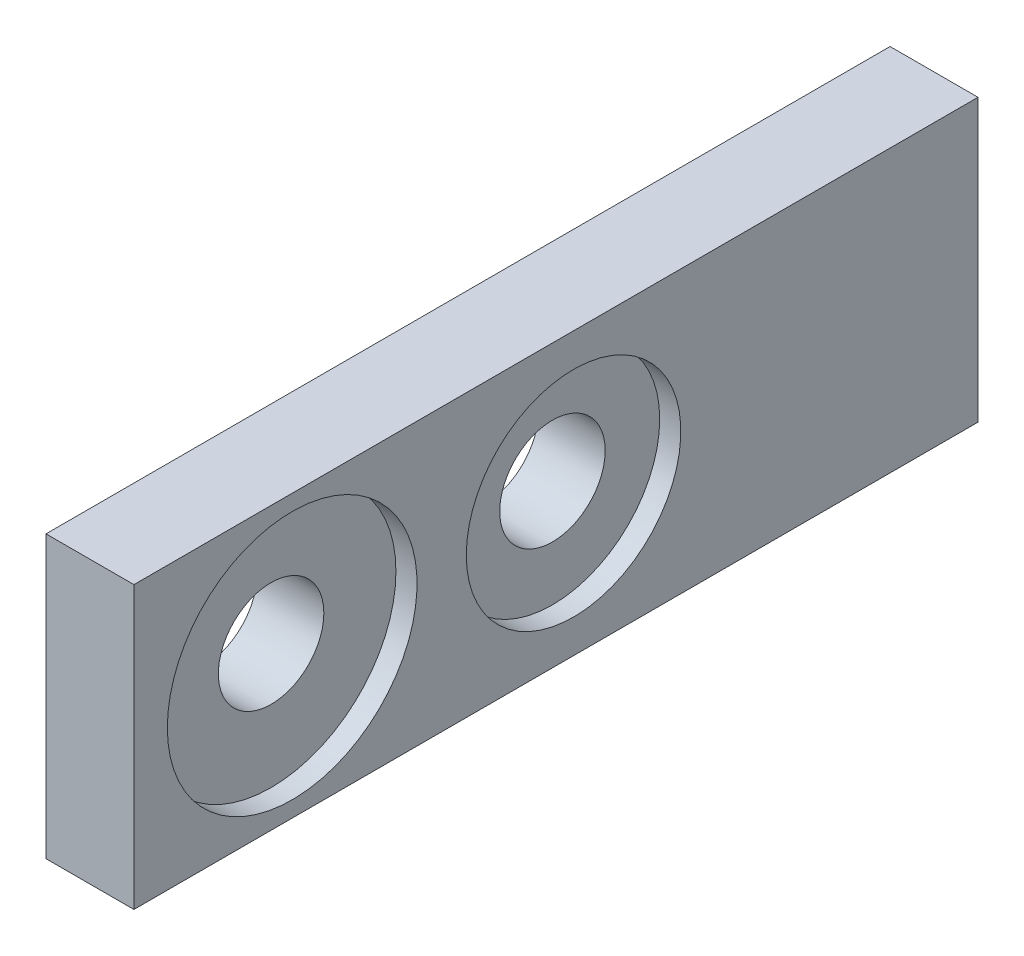
from build123d import *

# Parameters (mm, degrees)
BOSS_EXTRUDE1_START = 142
SKETCH1_W           = 5
SKETCH1_H           = 16
BOSS_EXTRUDE1_DEPTH = 48
BOSS_EXTRUDE2_START = 148.9
SKETCH2_W           = 3.1
SKETCH2_H           = 4.1
BOSS_EXTRUDE2_DEPTH = 2.2
BOSS_EXTRUDE3_START = -1.75
BOSS_EXTRUDE3_DEPTH = 3.5
BOSS_EXTRUDE4_START = 59.4
SKETCH4_R           = 6.1
BOSS_EXTRUDE4_DEPTH = 1.7
BOSS_EXTRUDE5_START = 55.1
SKETCH5_R           = 3
BOSS_EXTRUDE5_DEPTH = 4.4
BOSS_EXTRUDE6_START = 59.4
SKETCH6_R           = 7.1
BOSS_EXTRUDE6_DEPTH = 1.7
BOSS_EXTRUDE7_START = 55.1
SKETCH7_R           = 3
BOSS_EXTRUDE7_DEPTH = 4.4


with BuildPart() as part:
    # Sketch1 → Boss-Extrude1 (new body)
    with BuildSketch(Plane.XY.offset(BOSS_EXTRUDE1_START)):
        with Locations((58.1, 0)):
            Rectangle(SKETCH1_W, SKETCH1_H)
    extrude(amount=BOSS_EXTRUDE1_DEPTH)


with BuildPart() as body_2:
    # Sketch2 → Boss-Extrude2 (new body)
    with BuildSketch(Plane.XY.offset(BOSS_EXTRUDE2_START)):
        with Locations((57.05, 0)):
            Rectangle(SKETCH2_W, SKETCH2_H)
    extrude(amount=BOSS_EXTRUDE2_DEPTH)


with BuildPart() as part_1:
    add(part.part)

    # Combine1: cut body 2
    add(body_2.part, mode=Mode.SUBTRACT)

    # Sketch3 → Boss-Extrude3 (add)
    with BuildSketch(Plane(origin=(0, 0, 0), x_dir=(1, 0, 0), z_dir=(0, 1, 0)).offset(BOSS_EXTRUDE3_START)):
        Polygon((58.8, -149.5), (58.8, -150.5), (52.8, -150.5), (52.8, -150.9), (52.2, -150.9), (51.4, -150.1), (51.4, -149.5), align=None)
    extrude(amount=BOSS_EXTRUDE3_DEPTH)


with BuildPart() as body_2_2:
    # Sketch4 → Boss-Extrude4 (new body)
    with BuildSketch(Plane(origin=(0, 0, 0), x_dir=(0, 0, -1), z_dir=(1, 0, 0)).offset(BOSS_EXTRUDE4_START)):
        with Locations((-165, 0)):
            Circle(SKETCH4_R)
    extrude(amount=BOSS_EXTRUDE4_DEPTH)


with BuildPart() as part_2:
    add(part_1.part)

    # Combine2: cut body 2 2
    add(body_2_2.part, mode=Mode.SUBTRACT)


with BuildPart() as body_2_3:
    # Sketch5 → Boss-Extrude5 (new body)
    with BuildSketch(Plane(origin=(0, 0, 0), x_dir=(0, 0, -1), z_dir=(1, 0, 0)).offset(BOSS_EXTRUDE5_START)):
        with Locations((-165, 0)):
            Circle(SKETCH5_R)
    extrude(amount=BOSS_EXTRUDE5_DEPTH)


with BuildPart() as part_3:
    add(part_2.part)

    # Combine3: cut body 2 3
    add(body_2_3.part, mode=Mode.SUBTRACT)


with BuildPart() as body_2_4:
    # Sketch6 → Boss-Extrude6 (new body)
    with BuildSketch(Plane(origin=(0, 0, 0), x_dir=(0, 0, -1), z_dir=(1, 0, 0)).offset(BOSS_EXTRUDE6_START)):
        with Locations((-181, 0)):
            Circle(SKETCH6_R)
    extrude(amount=BOSS_EXTRUDE6_DEPTH)


with BuildPart() as part_4:
    add(part_3.part)

    # Combine4: cut body 2 4
    add(body_2_4.part, mode=Mode.SUBTRACT)


with BuildPart() as body_2_5:
    # Sketch7 → Boss-Extrude7 (new body)
    with BuildSketch(Plane(origin=(0, 0, 0), x_dir=(0, 0, -1), z_dir=(1, 0, 0)).offset(BOSS_EXTRUDE7_START)):
        with Locations((-181, 0)):
            Circle(SKETCH7_R)
    extrude(amount=BOSS_EXTRUDE7_DEPTH)


with BuildPart() as part_5:
    add(part_4.part)

    # Combine5: cut body 2 5
    add(body_2_5.part, mode=Mode.SUBTRACT)


solid = part_5.part
